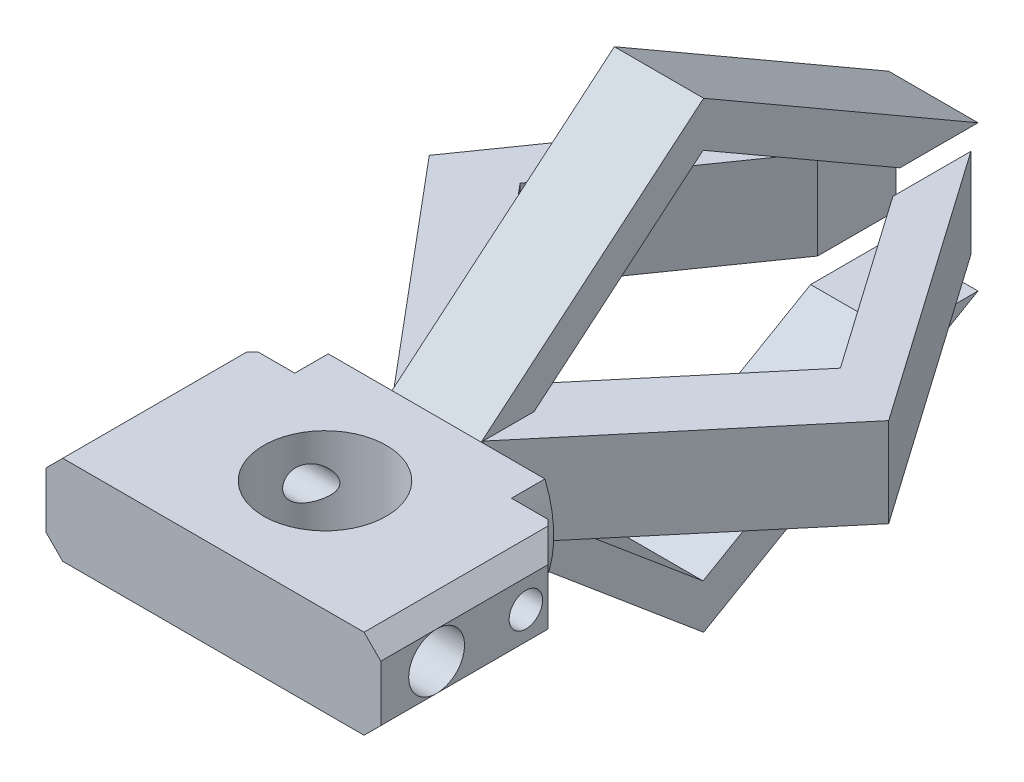
from build123d import *

# Parameters (mm, degrees)
IZIM2_R                          = 10.5
Y_KSEKLIK_EKSTR_ZYON1_DEPTH      = 3
Y_KSEKLIK_EKSTR_ZYON3_DEPTH      = 4
Y_KSEKLIK_EKSTR_ZYON3_DEPTH_BACK = 4
Y_KSEKLIK_EKSTR_ZYON6_DEPTH      = 4
Y_KSEKLIK_EKSTR_ZYON6_DEPTH_BACK = 4
IZIM5_W                          = 23.418755165
IZIM5_H                          = 7.378370442
IZIM5_H_2                        = 8.702399003
KES_EKSTR_ZYON1_DEPTH            = 3
IZIM6_W                          = 30
IZIM6_H                          = 8
Y_KSEKLIK_EKSTR_ZYON7_DEPTH      = 17
IZIM7_R                          = 2.5
KES_EKSTR_ZYON2_DEPTH            = 30
IZIM8_R                          = 1.5
KES_EKSTR_ZYON3_DEPTH            = 30
PAH1_SIZE                        = 1.5
PAH2_SIZE                        = 2
IZIM9_R                          = 5.5
KES_EKSTR_ZYON4_DEPTH            = 17


with BuildPart() as part:
    # Çizim2 → Yükseklik-Ekstrüzyon1 (new body)
    with BuildSketch(Plane.XY):
        Circle(IZIM2_R)
    extrude(amount=Y_KSEKLIK_EKSTR_ZYON1_DEPTH)

    # Çizim3 → Yükseklik-Ekstrüzyon3 (add, two sides: drawn at the far end of the back side and taken through both)
    with BuildSketch(Plane(origin=(0, 0, 0), x_dir=(1, 0, 0), z_dir=(0, 1, 0)).offset(-Y_KSEKLIK_EKSTR_ZYON3_DEPTH_BACK)):
        Polygon((-14.349740813, 21.832604096), (0, 4.731248928), (14.349740813, 21.832604096), (3.3694522, 37.514081392), (3.3694522, 44.514081392), (20.58445702, 19.928506573), (3.862454505, 0), (-3.862454505, 0), (-20.58445702, 19.928506573), (-3.3694522, 44.514081392), (-3.3694522, 37.514081392), align=None)
    extrude(amount=Y_KSEKLIK_EKSTR_ZYON3_DEPTH + Y_KSEKLIK_EKSTR_ZYON3_DEPTH_BACK)

    # Çizim4 → Yükseklik-Ekstrüzyon6 (add, two sides: drawn at the far end of the back side and taken through both)
    with BuildSketch(Plane(origin=(0, 0, 0), x_dir=(0, 0, -1), z_dir=(1, 0, 0)).offset(-Y_KSEKLIK_EKSTR_ZYON6_DEPTH_BACK)):
        Polygon((44.514081392, 6.527514275), (37.514081392, 6.527514275), (19.878054627, 16.709679075), (4.731248928, 4), (4.731248928, -4), (19.878054627, -16.709679075), (37.514081392, -6.527514275), (44.514081392, -6.527514275), (19.928506573, -20.722002515), (0, -4), (0, 4), (19.928506573, 20.722002515), align=None)
    extrude(amount=Y_KSEKLIK_EKSTR_ZYON6_DEPTH + Y_KSEKLIK_EKSTR_ZYON6_DEPTH_BACK)

    # Çizim5 → Kes-Ekstrüzyon1 (cut)
    with BuildSketch(Plane.XY.offset(3)):
        with Locations((0.537886602, 7.689185221)):
            Rectangle(IZIM5_W, IZIM5_H)
        with Locations((0.537886602, -8.351199502)):
            Rectangle(IZIM5_W, IZIM5_H_2)
    extrude(amount=-KES_EKSTR_ZYON1_DEPTH, mode=Mode.SUBTRACT)

    # Çizim6 → Yükseklik-Ekstrüzyon7 (add)
    with BuildSketch(Plane.XY.offset(3)):
        Rectangle(IZIM6_W, IZIM6_H)
    extrude(amount=Y_KSEKLIK_EKSTR_ZYON7_DEPTH)

    # Çizim7 → Kes-Ekstrüzyon2 (cut)
    with BuildSketch(Plane(origin=(15, 0, 0), x_dir=(0, 0, -1), z_dir=(1, 0, 0))):
        with Locations(Location((-15, 0, 0), (0, 0, 90))):
            Circle(IZIM7_R)
    extrude(amount=-KES_EKSTR_ZYON2_DEPTH, mode=Mode.SUBTRACT)

    # Çizim8 → Kes-Ekstrüzyon3 (cut)
    with BuildSketch(Plane.ZY.offset(15)):
        with Locations(Location((7, 0, 0), (0, 0, 270))):
            Circle(IZIM8_R)
    extrude(amount=-KES_EKSTR_ZYON3_DEPTH, mode=Mode.SUBTRACT)

    # Pah1
    pah1_edges = [part.edges().sort_by_distance(p)[0] for p in [
        (15, -4, 11.5),
        (15, 4, 11.5),
        (-15, -4, 11.5),
        (-15, 4, 11.5),
    ]]
    chamfer(pah1_edges, length=PAH1_SIZE - 0.0001)  # a hair under: the kernel refuses the full size

    # Pah2
    pah2_edges = [part.edges().sort_by_distance(p)[0] for p in [
        (15, 0, 3),
        (-15, 0, 3),
    ]]
    chamfer(pah2_edges, length=PAH2_SIZE)

    # Çizim9 → Kes-Ekstrüzyon4 (cut)
    with BuildSketch(Plane(origin=(0, 4, 0), x_dir=(1, 0, 0), z_dir=(0, 1, 0))):
        with Locations(Location((0, -10, 0), (0, 0, 270))):
            Circle(IZIM9_R)
    extrude(amount=-KES_EKSTR_ZYON4_DEPTH, mode=Mode.SUBTRACT)


solid = part.part
